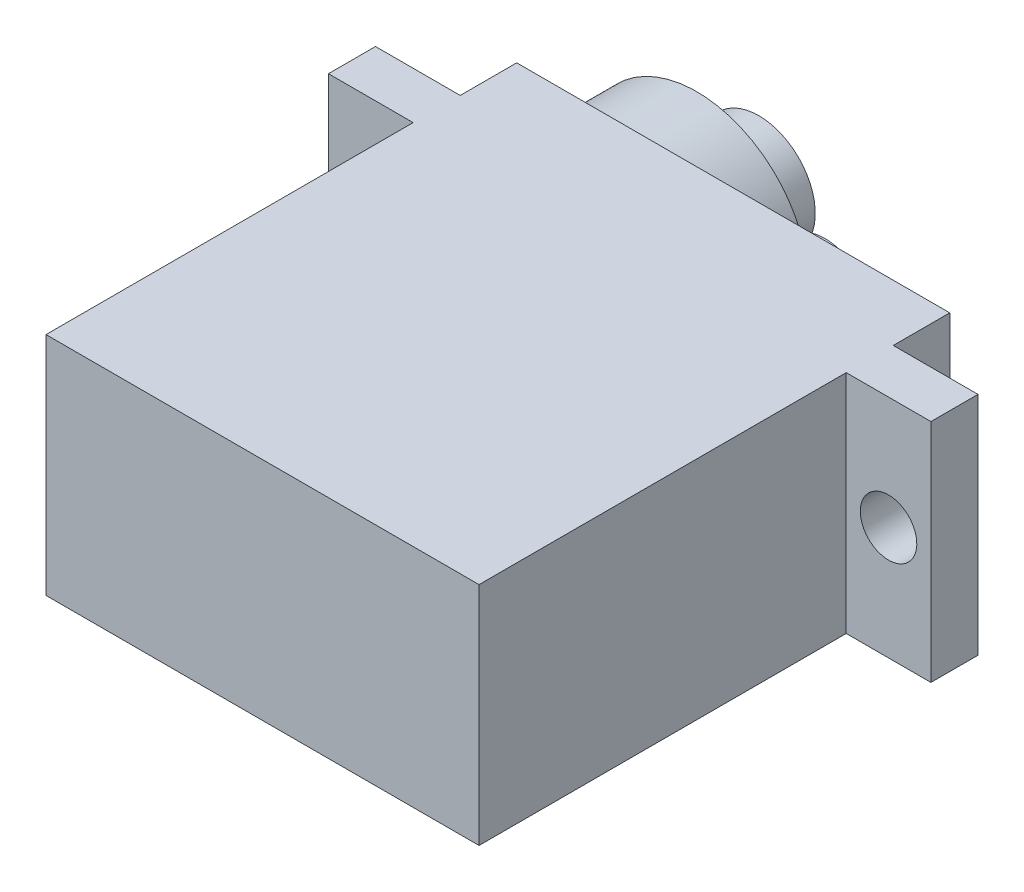
from build123d import *

# Parameters (mm, degrees)
SKETCH1_W            = 23
SKETCH1_H            = 12
BOSS_EXTRUDE1_DEPTH  = 25
SKETCH3_W            = 2.5
SKETCH3_H            = 12
BOSS_EXTRUDE2_DEPTH  = 4.5
SKETCH4_W            = 2.5
SKETCH4_H            = 12
BOSS_EXTRUDE3_DEPTH  = 4.5
BOSS_EXTRUDE13_DEPTH = 3.5
SKETCH7_R            = 3
BOSS_EXTRUDE14_DEPTH = 3.5
SKETCH8_R            = 1.5
CUT_EXTRUDE1_DEPTH   = 3.5
SKETCH9_W            = 0.717948718
SKETCH9_H            = 0.583333333
CUT_EXTRUDE2_DEPTH   = 3.5
CUT_EXTRUDE3_DEPTH   = 3.5


with BuildPart() as part:
    # Sketch1 → Boss-Extrude1 (new body)
    with BuildSketch(Plane.XY):
        Rectangle(SKETCH1_W, SKETCH1_H)
    extrude(amount=BOSS_EXTRUDE1_DEPTH)

    # Sketch3 → Boss-Extrude2 (add)
    with BuildSketch(Plane(origin=(11.5, 0, 0), x_dir=(0, 0, -1), z_dir=(1, 0, 0))):
        with Locations((-4.25, 0)):
            Rectangle(SKETCH3_W, SKETCH3_H)
    extrude(amount=BOSS_EXTRUDE2_DEPTH)

    # Sketch4 → Boss-Extrude3 (add)
    with BuildSketch(Plane.ZY.offset(11.5)):
        with Locations((4.25, 0)):
            Rectangle(SKETCH4_W, SKETCH4_H)
    extrude(amount=BOSS_EXTRUDE3_DEPTH)

    # Sketch5 → Boss-Extrude13 (add)
    with BuildSketch(Plane(origin=(0, 0, 0), x_dir=(-1, 0, 0), z_dir=(0, 0, -1))):
        with BuildLine():
            ThreePointArc((-0.158800231, -2.021525619), (11.397235464, -0.117666755), (-0.074559549, 2.241264938))
            ThreePointArc((-0.074559549, 2.241264938), (-3.841916946, 0.183487283), (-0.158800231, -2.021525619))
        make_face()
    extrude(amount=BOSS_EXTRUDE13_DEPTH)

    # Sketch7 → Boss-Extrude14 (add)
    with BuildSketch(Plane(origin=(0, 0, -3.5), x_dir=(-1, 0, 0), z_dir=(0, 0, -1))):
        with Locations((5.642948454, 0)):
            Circle(SKETCH7_R)
    extrude(amount=BOSS_EXTRUDE14_DEPTH)

    # Sketch8 → Cut-Extrude1 (cut)
    with BuildSketch(Plane(origin=(0, 0, 3), x_dir=(-1, 0, 0), z_dir=(0, 0, -1))):
        with Locations((13.75, 0)):
            Circle(SKETCH8_R)
        with Locations((-13.75, 0)):
            Circle(SKETCH8_R)
    extrude(amount=-CUT_EXTRUDE1_DEPTH, mode=Mode.SUBTRACT)

    # Sketch9 → Cut-Extrude2 (cut)
    # profile 1 of 11: a face of its own
    with BuildSketch(Plane(origin=(0, -6, 0), x_dir=(-1, 0, 0), z_dir=(0, -1, 0))):
        with BuildLine():
            Line((-7.029498247, -7.323823988), (-7.298027894, -7.753611648))
            add(Edge.make_bspline(
                [(-7.298027894, -7.753611648), (-7.309343943, -7.725405147), (-7.330742745, -7.67206627), (-7.366596226, -7.599110292), (-7.402048427, -7.536976801), (-7.437669123, -7.486031044), (-7.473342813, -7.445609931), (-7.510051839, -7.416967875), (-7.547391075, -7.398209945), (-7.57315305, -7.395794026), (-7.58548783, -7.394637289)],
                knots=[0, 0, 0, 0, 1.513815615, 2.862645992, 4.047036384, 5.074482221, 5.956489264, 6.720440714, 7.387349671, 8, 8, 8, 8], degree=3))
            add(Edge.make_bspline(
                [(-7.58548783, -7.394637289), (-7.597078949, -7.395347529), (-7.619923321, -7.396747306), (-7.652145088, -7.411117835), (-7.679882705, -7.434714408), (-7.703986223, -7.465346606), (-7.722832591, -7.501258769), (-7.73746031, -7.540032256), (-7.745812547, -7.581245339), (-7.746899403, -7.609612593), (-7.747446965, -7.623904116)],
                knots=[0, 0, 0, 0, 0.893609532, 1.761171542, 2.674367376, 3.692096672, 4.7611719, 5.803554826, 6.893423158, 8, 8, 8, 8], degree=3))
            add(Edge.make_bspline(
                [(-7.747446965, -7.623904116), (-7.746040801, -7.652926504), (-7.743255996, -7.710403249), (-7.724018118, -7.764627863), (-7.714494241, -7.791472225)],
                knots=[0, 0, 0, 0, 1.009882784, 2, 2, 2, 2], degree=3))
            add(Edge.make_bspline(
                [(-7.714494241, -7.791472225), (-7.70993126, -7.801576539), (-7.699600847, -7.824452317), (-7.679228853, -7.861731129), (-7.65443256, -7.907087444), (-7.623173349, -7.95968464), (-7.586968291, -8.019905491), (-7.544375288, -8.087358866), (-7.497172041, -8.16291293), (-7.463105842, -8.215468417), (-7.445263471, -8.242994661)],
                knots=[0, 0, 0, 0, 0.505642727, 1.144755719, 1.936997808, 2.864123586, 3.935666884, 5.142716957, 6.503481291, 8, 8, 8, 8], degree=3))
            add(Edge.make_bspline(
                [(-7.445263471, -8.242994661), (-7.428433752, -8.268466401), (-7.396524634, -8.316760774), (-7.351220266, -8.385429738), (-7.31258455, -8.447596047), (-7.276744718, -8.500875631), (-7.248657862, -8.548471469), (-7.223632855, -8.587378257), (-7.204722279, -8.619436993), (-7.194447371, -8.638634446), (-7.190055138, -8.646840815)],
                knots=[0, 0, 0, 0, 1.533370667, 2.907268025, 4.131626108, 5.209286774, 6.131298802, 6.906451117, 7.532538771, 8, 8, 8, 8], degree=3))
            add(Edge.make_bspline(
                [(-7.190055138, -8.646840815), (-7.172396418, -8.680546144), (-7.137886386, -8.746415698), (-7.093555709, -8.845726366), (-7.058270283, -8.94329484), (-7.030486093, -9.039544956), (-7.010140983, -9.136863357), (-6.995389221, -9.237289148), (-6.986011594, -9.341940728), (-6.985092666, -9.413380616), (-6.984626452, -9.44962527)],
                knots=[0, 0, 0, 0, 1.089275112, 2.128745462, 3.110876915, 4.057562893, 4.994575095, 5.955064899, 6.96251288, 8, 8, 8, 8], degree=3))
            add(Edge.make_bspline(
                [(-6.984626452, -9.44962527), (-6.985200407, -9.484929111), (-6.986323112, -9.553986437), (-6.994070481, -9.655363931), (-7.007053572, -9.751906874), (-7.026326206, -9.843603726), (-7.049890785, -9.930895441), (-7.079250427, -10.013384977), (-7.113820498, -10.091269489), (-7.153288607, -10.163620799), (-7.197254773, -10.229263325), (-7.244045537, -10.287406565), (-7.294789099, -10.336398045), (-7.349269969, -10.375896445), (-7.406665014, -10.407331907), (-7.467504995, -10.429980486), (-7.531821505, -10.443719884), (-7.575838856, -10.445180426), (-7.598108023, -10.44591934)],
                knots=[0, 0, 0, 0, 1.308901514, 2.560323035, 3.767398777, 4.917911796, 6.032053414, 7.117382618, 8.160844707, 9.188500245, 10.169045156, 11.086613897, 11.950745906, 12.775760447, 13.574509779, 14.369631732, 15.175167501, 16, 16, 16, 16], degree=3))
            add(Edge.make_bspline(
                [(-7.598108023, -10.44591934), (-7.615672816, -10.445404716), (-7.650308144, -10.444389947), (-7.70132971, -10.435565342), (-7.750573765, -10.421722693), (-7.798106651, -10.401495443), (-7.844280041, -10.376687509), (-7.888121693, -10.345117885), (-7.930256479, -10.308423051), (-7.97127568, -10.26630974), (-8.009624417, -10.217128995), (-8.047762594, -10.162752006), (-8.083069282, -10.101044351), (-8.118630879, -10.033881483), (-8.150934908, -9.959491072), (-8.182599858, -9.87900756), (-8.213675398, -9.792456372), (-8.231747156, -9.731804288), (-8.241036709, -9.700626872)],
                knots=[0, 0, 0, 0, 0.796343935, 1.570279377, 2.342178525, 3.112109005, 3.909229001, 4.715324593, 5.557166864, 6.44198091, 7.377558535, 8.383433228, 9.452692693, 10.600350218, 11.829778021, 13.129265353, 14.524336153, 16, 16, 16, 16], degree=3))
            Line((-8.241036709, -9.700626872), (-7.932543119, -9.368996263))
            add(Edge.make_bspline(
                [(-7.932543119, -9.368996263), (-7.920967347, -9.404169009), (-7.899161549, -9.470425484), (-7.863209485, -9.562231234), (-7.824656248, -9.639491931), (-7.785829595, -9.703495837), (-7.745247411, -9.753791903), (-7.702909219, -9.789765423), (-7.658524534, -9.813526945), (-7.627344513, -9.816341078), (-7.612130459, -9.817714212)],
                knots=[0, 0, 0, 0, 1.528548029, 2.879394288, 4.065931244, 5.088610491, 5.965669334, 6.719195773, 7.375041301, 8, 8, 8, 8], degree=3))
            add(Edge.make_bspline(
                [(-7.612130459, -9.817714212), (-7.596711982, -9.816567756), (-7.566047872, -9.814287695), (-7.523157313, -9.793375674), (-7.484154899, -9.761388037), (-7.451208415, -9.717325694), (-7.42351825, -9.665965963), (-7.403045396, -9.609540189), (-7.3909015, -9.548998342), (-7.38929582, -9.507407017), (-7.388472606, -9.486083603)],
                knots=[0, 0, 0, 0, 0.837168625, 1.664952531, 2.553613952, 3.571843386, 4.645016646, 5.730630069, 6.836519038, 8, 8, 8, 8], degree=3))
            add(Edge.make_bspline(
                [(-7.388472606, -9.486083603), (-7.388967485, -9.466184138), (-7.389962443, -9.426176072), (-7.399541042, -9.366265812), (-7.415018915, -9.306399624), (-7.433365102, -9.256392682), (-7.452100276, -9.214447434), (-7.469792333, -9.178751228), (-7.490536749, -9.138705908), (-7.516347866, -9.095577405), (-7.54413424, -9.047470668), (-7.57632928, -8.995751899), (-7.613135655, -8.940656896), (-7.638332314, -8.902300301), (-7.651393279, -8.882417738)],
                knots=[0, 0, 0, 0, 1.070477827, 2.152205962, 3.256735731, 4.394924439, 5.014414402, 5.728928141, 6.539236128, 7.441139399, 8.433599816, 9.529715778, 10.719501013, 12, 12, 12, 12], degree=3))
            add(Edge.make_bspline(
                [(-7.651393279, -8.882417738), (-7.676819062, -8.844678156), (-7.725791945, -8.771987529), (-7.793704535, -8.664800969), (-7.855877844, -8.565077118), (-7.909485343, -8.470828053), (-7.957451469, -8.384147933), (-7.998422152, -8.30407152), (-8.032150964, -8.230632702), (-8.067728126, -8.14223749), (-8.100790695, -8.035415776), (-8.129705466, -7.908163875), (-8.148165008, -7.781028603), (-8.150255293, -7.696179758), (-8.151293119, -7.654052353)],
                knots=[0, 0, 0, 0, 1.215094936, 2.340407834, 3.38829717, 4.352808642, 5.235400207, 6.033645607, 6.754161491, 7.392715116, 8.577000407, 9.735214796, 10.875535395, 12, 12, 12, 12], degree=3))
            add(Edge.make_bspline(
                [(-8.151293119, -7.654052353), (-8.150637107, -7.624128785), (-8.149348939, -7.565369739), (-8.142675372, -7.478642994), (-8.129617343, -7.395419026), (-8.113359544, -7.315083461), (-8.090559094, -7.238345333), (-8.063181821, -7.164892487), (-8.031881703, -7.094198385), (-7.994840244, -7.028300352), (-7.954630779, -6.967760444), (-7.912166987, -6.91376928), (-7.866172711, -6.86899738), (-7.819113161, -6.830839287), (-7.768744329, -6.801693794), (-7.715955418, -6.781376969), (-7.660850155, -6.768897039), (-7.623413368, -6.767261849), (-7.604418119, -6.766432161)],
                knots=[0, 0, 0, 0, 1.254354283, 2.463097322, 3.641944594, 4.783035432, 5.895733406, 6.992845328, 8.066935729, 9.132461787, 10.156622158, 11.111156399, 12.004638905, 12.841397578, 13.64445675, 14.432075676, 15.204442572, 16, 16, 16, 16], degree=3))
            add(Edge.make_bspline(
                [(-7.604418119, -6.766432161), (-7.579701186, -6.767957205), (-7.529956598, -6.771026464), (-7.457024144, -6.79520617), (-7.385927751, -6.832795059), (-7.330125303, -6.877173564), (-7.285117732, -6.919763239), (-7.250970324, -6.959816511), (-7.21527572, -7.004925927), (-7.179413926, -7.056929623), (-7.142445177, -7.114544696), (-7.10547456, -7.179008561), (-7.066580015, -7.248726594), (-7.042133538, -7.298235203), (-7.029498247, -7.323823988)],
                knots=[0, 0, 0, 0, 1.053770877, 2.120788981, 3.250439966, 4.474277998, 5.151977451, 5.894695425, 6.719345712, 7.608185047, 8.591126753, 9.642247106, 10.781383004, 12, 12, 12, 12], degree=3))
        make_face()
    # profile 2 of 11: a face of its own
    with BuildSketch(Plane(origin=(0, -6, 0), x_dir=(-1, 0, 0), z_dir=(0, -1, 0))):
        with BuildLine():
            Line((-5.146285106, -9.234380879), (-6.311549529, -9.234380879))
            add(Edge.make_bspline(
                [(-6.311549529, -9.234380879), (-6.306325159, -9.280079102), (-6.296359408, -9.367250772), (-6.268727943, -9.490307519), (-6.229548505, -9.598535661), (-6.187741691, -9.678199446), (-6.148740521, -9.732350742), (-6.118623352, -9.767579666), (-6.085313316, -9.796155281), (-6.050845986, -9.820248631), (-6.014804807, -9.839678394), (-5.976489363, -9.853067752), (-5.936064353, -9.860866812), (-5.908438342, -9.862006253), (-5.894382061, -9.862586007)],
                knots=[0, 0, 0, 0, 2.00293182, 3.820693659, 5.479502867, 7.005516046, 7.72038845, 8.384130814, 9.019139803, 9.626361114, 10.213887248, 10.796719121, 11.387763407, 12, 12, 12, 12], degree=3))
            add(Edge.make_bspline(
                [(-5.894382061, -9.862586007), (-5.877468488, -9.861809188), (-5.843861484, -9.860265661), (-5.794919901, -9.846819394), (-5.747468972, -9.826147635), (-5.70222997, -9.796524467), (-5.658944615, -9.758482923), (-5.617538862, -9.712633541), (-5.57818911, -9.658118901), (-5.554691698, -9.617878529), (-5.54241892, -9.596860847)],
                knots=[0, 0, 0, 0, 0.874505432, 1.73762853, 2.610205243, 3.546913647, 4.52501498, 5.587546354, 6.739967356, 8, 8, 8, 8], degree=3))
            Line((-5.54241892, -9.596860847), (-5.234626452, -9.847161328))
            add(Edge.make_bspline(
                [(-5.234626452, -9.847161328), (-5.254531798, -9.891544655), (-5.292638075, -9.976510946), (-5.361340284, -10.09123749), (-5.435863388, -10.187879858), (-5.516304942, -10.267017519), (-5.605185723, -10.326970484), (-5.701153325, -10.37072263), (-5.805648333, -10.396409631), (-5.877882453, -10.399481302), (-5.914714593, -10.401047545)],
                knots=[0, 0, 0, 0, 1.245748866, 2.384829348, 3.417529423, 4.366306972, 5.263314617, 6.150552003, 7.056967443, 8, 8, 8, 8], degree=3))
            add(Edge.make_bspline(
                [(-5.914714593, -10.401047545), (-5.943789025, -10.400079317), (-6.00085766, -10.398178834), (-6.084282705, -10.379817486), (-6.16328874, -10.350159208), (-6.238485608, -10.309030801), (-6.309156313, -10.255749198), (-6.374998152, -10.190284993), (-6.437950244, -10.11440961), (-6.494215025, -10.02657624), (-6.547012456, -9.931438062), (-6.591428203, -9.828256281), (-6.630247513, -9.719986705), (-6.660779861, -9.605414281), (-6.685525816, -9.485369208), (-6.702702657, -9.359114038), (-6.713489957, -9.2270912), (-6.714752274, -9.137180149), (-6.715395683, -9.091352033)],
                knots=[0, 0, 0, 0, 0.821815462, 1.613097244, 2.404213167, 3.20336093, 4.030085173, 4.899993948, 5.825570722, 6.814305267, 7.847285877, 8.901600145, 9.989363176, 11.099614129, 12.254019607, 13.455929952, 14.703274657, 16, 16, 16, 16], degree=3))
            add(Edge.make_bspline(
                [(-6.715395683, -9.091352033), (-6.714769522, -9.04435348), (-6.713540495, -8.95210487), (-6.702536354, -8.817110275), (-6.686390583, -8.687948635), (-6.661331541, -8.565185413), (-6.631125171, -8.448064461), (-6.592895396, -8.337295051), (-6.548210201, -8.232619605), (-6.496698359, -8.135148557), (-6.440300083, -8.0464389), (-6.380502959, -7.967795745), (-6.315564782, -7.902248154), (-6.247653554, -7.848177884), (-6.176588259, -7.805112374), (-6.101058136, -7.77585536), (-6.022509258, -7.756335671), (-5.968585177, -7.754525606), (-5.941357221, -7.753611648)],
                knots=[0, 0, 0, 0, 1.327688858, 2.605983448, 3.824748862, 5.003224592, 6.143621814, 7.239960965, 8.310787262, 9.356458241, 10.351137754, 11.278365338, 12.142196764, 12.950725969, 13.72647493, 14.479375456, 15.232189105, 16, 16, 16, 16], degree=3))
            add(Edge.make_bspline(
                [(-5.941357221, -7.753611648), (-5.912517194, -7.754592788), (-5.855683847, -7.756526262), (-5.772498053, -7.77486093), (-5.693647462, -7.804355117), (-5.618628453, -7.845763054), (-5.548862021, -7.899505749), (-5.482620753, -7.96437921), (-5.421343925, -8.041231889), (-5.364068682, -8.128773716), (-5.312644593, -8.225783835), (-5.267853702, -8.330982123), (-5.228897216, -8.443258005), (-5.198852348, -8.563555764), (-5.17370723, -8.690751897), (-5.157747676, -8.825776848), (-5.146685417, -8.968237405), (-5.145493706, -9.065854814), (-5.144882862, -9.115891295)],
                knots=[0, 0, 0, 0, 0.792468507, 1.561671118, 2.330712499, 3.101927644, 3.909457693, 4.746001565, 5.646670277, 6.607816118, 7.620234016, 8.662823515, 9.750583281, 10.885796409, 12.071047244, 13.315069537, 14.623765234, 16, 16, 16, 16], degree=3))
            Line((-5.144882862, -9.115891295), (-5.146285106, -9.234380879))
        make_face()
        with BuildLine():
            add(Edge.make_bspline(
                [(-5.548729016, -8.740791135), (-5.555269335, -8.709063276), (-5.56796213, -8.647489026), (-5.597928429, -8.561060973), (-5.63708051, -8.484067767), (-5.683276893, -8.417037619), (-5.73613521, -8.361806873), (-5.794461369, -8.321156473), (-5.858157507, -8.296426663), (-5.90235469, -8.293527713), (-5.924530298, -8.292073186)],
                knots=[0, 0, 0, 0, 1.225910497, 2.379124237, 3.451785653, 4.487896126, 5.451744876, 6.330575134, 7.162378472, 8, 8, 8, 8], degree=3))
            add(Edge.make_bspline(
                [(-5.924530298, -8.292073186), (-5.948659415, -8.293511394), (-5.99682712, -8.296382412), (-6.065158946, -8.325747693), (-6.129540604, -8.369808124), (-6.164277485, -8.41076255), (-6.182543119, -8.432297545)],
                knots=[0, 0, 0, 0, 0.947074985, 1.890596711, 2.890816105, 4, 4, 4, 4], degree=3))
            add(Edge.make_bspline(
                [(-6.182543119, -8.432297545), (-6.194563645, -8.44926456), (-6.221246631, -8.486927688), (-6.25161414, -8.557557476), (-6.284585999, -8.642719583), (-6.302110697, -8.706460286), (-6.311549529, -8.740791135)],
                knots=[0, 0, 0, 0, 0.740226917, 1.643144803, 2.730593836, 4, 4, 4, 4], degree=3))
            Line((-6.311549529, -8.740791135), (-5.548729016, -8.740791135))
        make_face(mode=Mode.SUBTRACT)
    # profile 3 of 11: a face of its own
    with BuildSketch(Plane(origin=(0, -6, 0), x_dir=(-1, 0, 0), z_dir=(0, -1, 0))):
        with BuildLine():
            Line((-4.875652093, -7.798483443), (-4.516677734, -7.798483443))
            Line((-4.516677734, -7.798483443), (-4.516677734, -8.113287129))
            add(Edge.make_bspline(
                [(-4.516677734, -8.113287129), (-4.509152221, -8.08558455), (-4.494819951, -8.032825245), (-4.468029556, -7.960001417), (-4.436861909, -7.897954746), (-4.402979733, -7.846403038), (-4.365704323, -7.805550557), (-4.326032337, -7.776201501), (-4.284386769, -7.756803574), (-4.255347877, -7.754660448), (-4.241136869, -7.753611648)],
                knots=[0, 0, 0, 0, 1.423334253, 2.710726865, 3.840736876, 4.859788011, 5.761921624, 6.566363284, 7.298409075, 8, 8, 8, 8], degree=3))
            add(Edge.make_bspline(
                [(-4.241136869, -7.753611648), (-4.230784773, -7.754621592), (-4.209079113, -7.756739183), (-4.176137948, -7.768289243), (-4.143971776, -7.789644485), (-4.12360535, -7.80734768), (-4.11283158, -7.81671261)],
                knots=[0, 0, 0, 0, 0.851681845, 1.785755831, 2.828672471, 4, 4, 4, 4], degree=3))
            Line((-4.11283158, -7.81671261), (-4.21028751, -8.348864052))
            add(Edge.make_bspline(
                [(-4.21028751, -8.348864052), (-4.219040043, -8.340528617), (-4.235043981, -8.325287338), (-4.258474749, -8.306750341), (-4.280063556, -8.294687373), (-4.294316354, -8.29288467), (-4.300732221, -8.292073186)],
                knots=[0, 0, 0, 0, 1.329240489, 2.430505927, 3.293495475, 4, 4, 4, 4], degree=3))
            add(Edge.make_bspline(
                [(-4.300732221, -8.292073186), (-4.306652183, -8.292675533), (-4.319056295, -8.29393763), (-4.337127405, -8.302890747), (-4.353021257, -8.318460753), (-4.368799902, -8.338742781), (-4.384066934, -8.364567001), (-4.397749667, -8.396858786), (-4.411789769, -8.434151991), (-4.424465191, -8.478239234), (-4.436868726, -8.530258462), (-4.445989533, -8.592927592), (-4.454372485, -8.666579242), (-4.461167527, -8.751237733), (-4.466665749, -8.846847454), (-4.470976672, -8.953429094), (-4.472786842, -9.071013014), (-4.473063797, -9.153050472), (-4.473208183, -9.19581918)],
                knots=[0, 0, 0, 0, 0.296809874, 0.621906527, 0.987026169, 1.404480485, 1.909126721, 2.486431564, 3.16151366, 3.907118283, 4.785817413, 5.842019697, 7.080977384, 8.504330977, 10.101453798, 11.884780886, 13.854606785, 16, 16, 16, 16], degree=3))
            Line((-4.473208183, -9.19581918), (-4.471805939, -9.32061886))
            Line((-4.471805939, -9.32061886), (-4.471805939, -10.356175751))
            Line((-4.471805939, -10.356175751), (-4.875652093, -10.356175751))
            Line((-4.875652093, -10.356175751), (-4.875652093, -7.798483443))
        make_face()
    # profile 4 of 11: a face of its own
    with BuildSketch(Plane(origin=(0, -6, 0), x_dir=(-1, 0, 0), z_dir=(0, -1, 0))):
        Polygon((-4.135267478, -7.798483443), (-3.720904497, -7.798483443), (-3.372446965, -9.307998667), (-3.025391677, -7.798483443), (-2.609626452, -7.798483443), (-3.197166516, -10.356175751), (-3.547026292, -10.356175751), align=None)
    # profile 5 of 11: a face of its own
    with BuildSketch(Plane(origin=(0, -6, 0), x_dir=(-1, 0, 0), z_dir=(0, -1, 0))):
        with BuildLine():
            add(Edge.make_bspline(
                [(-1.586689753, -7.753611648), (-1.56913012, -7.754153523), (-1.534043569, -7.755236265), (-1.481830128, -7.763945582), (-1.430576268, -7.778286737), (-1.379666167, -7.796814775), (-1.330312244, -7.822883806), (-1.281512542, -7.853515202), (-1.23321266, -7.889619504), (-1.170529875, -7.946474736), (-1.095620789, -8.028035742), (-1.017644612, -8.142278298), (-0.950486971, -8.27251217), (-0.893821535, -8.41660787), (-0.848773065, -8.57159092), (-0.81579486, -8.734057126), (-0.795688692, -8.902709892), (-0.793452019, -9.017211508), (-0.79231876, -9.075226231)],
                knots=[0, 0, 0, 0, 0.498953948, 0.996978292, 1.499809037, 2.010650751, 2.533574202, 3.082841117, 3.647519731, 4.245008617, 5.486430885, 6.785561185, 8.164293431, 9.643418898, 11.180142746, 12.746181886, 14.351382572, 16, 16, 16, 16], degree=3))
            add(Edge.make_bspline(
                [(-0.79231876, -9.075226231), (-0.793450515, -9.133708309), (-0.795684403, -9.24914181), (-0.815816407, -9.419185645), (-0.848801485, -9.583574845), (-0.894390361, -9.740357172), (-0.951240496, -9.885912806), (-1.017106852, -10.017147004), (-1.095232524, -10.130097055), (-1.167348242, -10.212334939), (-1.230190889, -10.267035559), (-1.277062999, -10.303323175), (-1.325553952, -10.333410002), (-1.374960304, -10.358334404), (-1.425725807, -10.377460354), (-1.477982676, -10.390549883), (-1.53123144, -10.39947694), (-1.567256169, -10.400523643), (-1.58528751, -10.401047545)],
                knots=[0, 0, 0, 0, 1.656264952, 3.269180419, 4.842891851, 6.401686251, 7.888119366, 9.265016889, 10.550538073, 11.769515322, 12.351239632, 12.908722698, 13.447003998, 13.965161284, 14.474272309, 14.980100942, 15.489513229, 16, 16, 16, 16], degree=3))
            add(Edge.make_bspline(
                [(-1.58528751, -10.401047545), (-1.611788625, -10.399747841), (-1.664205912, -10.397177119), (-1.741307704, -10.379149547), (-1.814910405, -10.348398616), (-1.885579108, -10.305668126), (-1.953505769, -10.251001222), (-2.01759198, -10.183666702), (-2.079893203, -10.105425058), (-2.136848867, -10.015380911), (-2.189909642, -9.917368345), (-2.236050108, -9.812704111), (-2.275283117, -9.703029219), (-2.307912784, -9.588348928), (-2.33177345, -9.468189943), (-2.350405044, -9.343305763), (-2.360852019, -9.21305946), (-2.36216312, -9.124556129), (-2.36283158, -9.079432962)],
                knots=[0, 0, 0, 0, 0.757268579, 1.497822431, 2.249620092, 3.028674568, 3.8507904, 4.734238136, 5.680514419, 6.70524415, 7.775287347, 8.863936352, 9.971180801, 11.102605878, 12.268626126, 13.470344302, 14.710262363, 16, 16, 16, 16], degree=3))
            add(Edge.make_bspline(
                [(-2.36283158, -9.079432962), (-2.36198828, -9.031266286), (-2.360335868, -8.936885713), (-2.348434169, -8.798435518), (-2.328005652, -8.666151393), (-2.300110978, -8.539852281), (-2.264552822, -8.41944134), (-2.220235742, -8.305481146), (-2.167729334, -8.197527373), (-2.126182485, -8.130029233), (-2.105519882, -8.096460206)],
                knots=[0, 0, 0, 0, 1.121811857, 2.198143086, 3.233602208, 4.237311924, 5.208646479, 6.154808683, 7.082326169, 8, 8, 8, 8], degree=3))
            add(Edge.make_bspline(
                [(-2.105519882, -8.096460206), (-2.086863778, -8.069203662), (-2.050972459, -8.016766493), (-1.990847872, -7.946964112), (-1.929072907, -7.887507303), (-1.865175479, -7.838443165), (-1.798554743, -7.800781375), (-1.729910087, -7.77384984), (-1.659014543, -7.756946921), (-1.610852535, -7.75472592), (-1.586689753, -7.753611648)],
                knots=[0, 0, 0, 0, 1.220761442, 2.348547062, 3.400027255, 4.38708449, 5.319780212, 6.220200227, 7.107078062, 8, 8, 8, 8], degree=3))
        make_face()
        with BuildLine():
            add(Edge.make_bspline(
                [(-1.578276292, -8.336944981), (-1.591631348, -8.337754655), (-1.618177287, -8.339364048), (-1.657489175, -8.348179342), (-1.693948855, -8.365808097), (-1.729260203, -8.38869467), (-1.762399985, -8.418293711), (-1.794811462, -8.453793459), (-1.823404799, -8.496984174), (-1.861875626, -8.56272102), (-1.901780468, -8.657078443), (-1.934908246, -8.783377264), (-1.955297424, -8.923828567), (-1.957719445, -9.022335029), (-1.958985427, -9.073823988)],
                knots=[0, 0, 0, 0, 0.531406066, 1.056279542, 1.588172318, 2.131694732, 2.724043708, 3.348779607, 4.036600694, 4.777313526, 6.374828638, 8.087010827, 9.95469519, 12, 12, 12, 12], degree=3))
            add(Edge.make_bspline(
                [(-1.958985427, -9.073823988), (-1.957643168, -9.126702501), (-1.955085026, -9.227480905), (-1.935867363, -9.37108169), (-1.902678958, -9.498956488), (-1.86307906, -9.59397562), (-1.825357358, -9.659724534), (-1.795401148, -9.70141012), (-1.765074113, -9.738084643), (-1.731011455, -9.766468995), (-1.696138263, -9.789974694), (-1.658857655, -9.806133124), (-1.61961714, -9.815375748), (-1.59304618, -9.816931517), (-1.579678535, -9.817714212)],
                knots=[0, 0, 0, 0, 2.083844641, 3.971490933, 5.696411459, 7.277284296, 8.011958627, 8.679080092, 9.299544049, 9.881039513, 10.420130978, 10.952331548, 11.472926106, 12, 12, 12, 12], degree=3))
            add(Edge.make_bspline(
                [(-1.579678535, -9.817714212), (-1.566062983, -9.817011198), (-1.539173644, -9.815622815), (-1.500044343, -9.805407021), (-1.462992695, -9.788897133), (-1.42744113, -9.766093212), (-1.393852803, -9.736387453), (-1.362299726, -9.700030335), (-1.331864478, -9.65776583), (-1.294398195, -9.59093628), (-1.253854339, -9.495751283), (-1.220179805, -9.368052738), (-1.199855651, -9.22568146), (-1.197433311, -9.126012918), (-1.196164914, -9.073823988)],
                knots=[0, 0, 0, 0, 0.535648601, 1.05785183, 1.581026902, 2.127240038, 2.714100245, 3.339916738, 4.019124428, 4.76094841, 6.352116621, 8.077481587, 9.946071712, 12, 12, 12, 12], degree=3))
            add(Edge.make_bspline(
                [(-1.196164914, -9.073823988), (-1.197505926, -9.02164797), (-1.200060151, -8.922268393), (-1.219293688, -8.780498167), (-1.252714787, -8.654169642), (-1.291706605, -8.559716129), (-1.330325832, -8.49484403), (-1.359142535, -8.452301573), (-1.391112544, -8.417135783), (-1.424262979, -8.387416684), (-1.460252628, -8.365143015), (-1.497843512, -8.348317324), (-1.537664604, -8.339322334), (-1.564682554, -8.33774074), (-1.578276292, -8.336944981)],
                knots=[0, 0, 0, 0, 2.065846563, 3.934814648, 5.649911842, 7.229656319, 7.959772155, 8.637571837, 9.260110413, 9.837317662, 10.3945175, 10.929205137, 11.461243205, 12, 12, 12, 12], degree=3))
        make_face(mode=Mode.SUBTRACT)
    # profile 6 of 11: a face of its own
    with BuildSketch(Plane(origin=(0, -6, 0), x_dir=(-1, 0, 0), z_dir=(0, -1, 0))):
        with Locations((-0.029498247, -9.077329597)):
            Rectangle(SKETCH9_W, SKETCH9_H)
    # profile 7 of 11: a face of its own
    with BuildSketch(Plane(origin=(0, -6, 0), x_dir=(-1, 0, 0), z_dir=(0, -1, 0))):
        Polygon((0.909303836, -6.856175751), (1.390974509, -6.856175751), (1.787809445, -9.29748184), (2.186046625, -6.856175751), (2.664211689, -6.856175751), (2.976912009, -10.356175751), (2.568158003, -10.356175751), (2.371142779, -8.145538731), (2.010766176, -10.356175751), (1.563450471, -10.356175751), (1.204476112, -8.145538731), (1.008162009, -10.356175751), (0.598706881, -10.356175751), align=None)
    # profile 8 of 11: a face of its own
    with BuildSketch(Plane(origin=(0, -6, 0), x_dir=(-1, 0, 0), z_dir=(0, -1, 0))):
        with BuildLine():
            add(Edge.make_bspline(
                [(4.022284606, -7.753611648), (4.039844239, -7.754153523), (4.07493079, -7.755236265), (4.127144231, -7.763945582), (4.178398091, -7.778286737), (4.229308192, -7.796814775), (4.278662115, -7.822883806), (4.327461817, -7.853515202), (4.375761699, -7.889619504), (4.438444484, -7.946474736), (4.51335357, -8.028035742), (4.591329747, -8.142278298), (4.658487388, -8.27251217), (4.715152824, -8.41660787), (4.760201294, -8.57159092), (4.793179499, -8.734057126), (4.813285667, -8.902709892), (4.81552234, -9.017211508), (4.816655599, -9.075226231)],
                knots=[0, 0, 0, 0, 0.498953948, 0.996978292, 1.499809037, 2.010650751, 2.533574202, 3.082841117, 3.647519731, 4.245008617, 5.486430885, 6.785561185, 8.164293431, 9.643418898, 11.180142746, 12.746181886, 14.351382572, 16, 16, 16, 16], degree=3))
            add(Edge.make_bspline(
                [(4.816655599, -9.075226231), (4.815523844, -9.133708309), (4.813289956, -9.24914181), (4.793157952, -9.419185645), (4.760172874, -9.583574845), (4.714583998, -9.740357172), (4.657733863, -9.885912806), (4.591867507, -10.017147004), (4.513741835, -10.130097055), (4.441626117, -10.212334939), (4.37878347, -10.267035559), (4.33191136, -10.303323175), (4.283420407, -10.333410002), (4.234014055, -10.358334404), (4.183248552, -10.377460354), (4.130991683, -10.390549883), (4.077742919, -10.39947694), (4.04171819, -10.400523643), (4.023686849, -10.401047545)],
                knots=[0, 0, 0, 0, 1.656264952, 3.269180419, 4.842891851, 6.401686251, 7.888119366, 9.265016889, 10.550538073, 11.769515322, 12.351239632, 12.908722698, 13.447003998, 13.965161284, 14.474272309, 14.980100942, 15.489513229, 16, 16, 16, 16], degree=3))
            add(Edge.make_bspline(
                [(4.023686849, -10.401047545), (3.997185734, -10.399747841), (3.944768447, -10.397177119), (3.867666655, -10.379149547), (3.794063954, -10.348398616), (3.723395251, -10.305668126), (3.65546859, -10.251001222), (3.591382379, -10.183666702), (3.529081156, -10.105425058), (3.472125492, -10.015380911), (3.419064717, -9.917368345), (3.372924251, -9.812704111), (3.333691242, -9.703029219), (3.301061575, -9.588348928), (3.277200909, -9.468189943), (3.258569315, -9.343305763), (3.24812234, -9.21305946), (3.246811239, -9.124556129), (3.246142779, -9.079432962)],
                knots=[0, 0, 0, 0, 0.757268579, 1.497822431, 2.249620092, 3.028674568, 3.8507904, 4.734238136, 5.680514419, 6.70524415, 7.775287347, 8.863936352, 9.971180801, 11.102605878, 12.268626126, 13.470344302, 14.710262363, 16, 16, 16, 16], degree=3))
            add(Edge.make_bspline(
                [(3.246142779, -9.079432962), (3.246986079, -9.031266286), (3.248638491, -8.936885713), (3.26054019, -8.798435518), (3.280968707, -8.666151393), (3.308863381, -8.539852281), (3.344421537, -8.41944134), (3.388738617, -8.305481146), (3.441245025, -8.197527373), (3.482791874, -8.130029233), (3.503454477, -8.096460206)],
                knots=[0, 0, 0, 0, 1.121811857, 2.198143086, 3.233602208, 4.237311924, 5.208646479, 6.154808683, 7.082326169, 8, 8, 8, 8], degree=3))
            add(Edge.make_bspline(
                [(3.503454477, -8.096460206), (3.522110581, -8.069203662), (3.5580019, -8.016766493), (3.618126487, -7.946964112), (3.679901452, -7.887507303), (3.74379888, -7.838443165), (3.810419616, -7.800781375), (3.879064272, -7.77384984), (3.949959816, -7.756946921), (3.998121824, -7.75472592), (4.022284606, -7.753611648)],
                knots=[0, 0, 0, 0, 1.220761442, 2.348547062, 3.400027255, 4.38708449, 5.319780212, 6.220200227, 7.107078062, 8, 8, 8, 8], degree=3))
        make_face()
        with BuildLine():
            add(Edge.make_bspline(
                [(4.030698067, -8.336944981), (4.017343011, -8.337754655), (3.990797072, -8.339364048), (3.951485184, -8.348179342), (3.915025504, -8.365808097), (3.879714156, -8.38869467), (3.846574373, -8.418293711), (3.814162897, -8.453793459), (3.78556956, -8.496984174), (3.747098733, -8.56272102), (3.707193891, -8.657078443), (3.674066113, -8.783377264), (3.653676935, -8.923828567), (3.651254914, -9.022335029), (3.649988932, -9.073823988)],
                knots=[0, 0, 0, 0, 0.531406066, 1.056279542, 1.588172318, 2.131694732, 2.724043708, 3.348779607, 4.036600694, 4.777313526, 6.374828638, 8.087010827, 9.95469519, 12, 12, 12, 12], degree=3))
            add(Edge.make_bspline(
                [(3.649988932, -9.073823988), (3.651331191, -9.126702501), (3.653889333, -9.227480905), (3.673106996, -9.37108169), (3.706295401, -9.498956488), (3.745895299, -9.59397562), (3.783617, -9.659724534), (3.813573211, -9.70141012), (3.843900246, -9.738084643), (3.877962904, -9.766468995), (3.912836095, -9.789974694), (3.950116704, -9.806133124), (3.989357219, -9.815375748), (4.015928179, -9.816931517), (4.029295823, -9.817714212)],
                knots=[0, 0, 0, 0, 2.083844641, 3.971490933, 5.696411459, 7.277284296, 8.011958627, 8.679080092, 9.299544049, 9.881039513, 10.420130978, 10.952331548, 11.472926106, 12, 12, 12, 12], degree=3))
            add(Edge.make_bspline(
                [(4.029295823, -9.817714212), (4.042911376, -9.817011198), (4.069800715, -9.815622815), (4.108930016, -9.805407021), (4.145981664, -9.788897133), (4.181533229, -9.766093212), (4.215121556, -9.736387453), (4.246674633, -9.700030335), (4.277109881, -9.65776583), (4.314576164, -9.59093628), (4.35512002, -9.495751283), (4.388794554, -9.368052738), (4.409118708, -9.22568146), (4.411541048, -9.126012918), (4.412809445, -9.073823988)],
                knots=[0, 0, 0, 0, 0.535648601, 1.05785183, 1.581026902, 2.127240038, 2.714100245, 3.339916738, 4.019124428, 4.76094841, 6.352116621, 8.077481587, 9.946071712, 12, 12, 12, 12], degree=3))
            add(Edge.make_bspline(
                [(4.412809445, -9.073823988), (4.411468433, -9.02164797), (4.408914208, -8.922268393), (4.389680671, -8.780498167), (4.356259572, -8.654169642), (4.317267754, -8.559716129), (4.278648527, -8.49484403), (4.249831824, -8.452301573), (4.217861815, -8.417135783), (4.18471138, -8.387416684), (4.148721731, -8.365143015), (4.111130847, -8.348317324), (4.071309755, -8.339322334), (4.044291805, -8.33774074), (4.030698067, -8.336944981)],
                knots=[0, 0, 0, 0, 2.065846563, 3.934814648, 5.649911842, 7.229656319, 7.959772155, 8.637571837, 9.260110413, 9.837317662, 10.3945175, 10.929205137, 11.461243205, 12, 12, 12, 12], degree=3))
        make_face(mode=Mode.SUBTRACT)
    # profile 9 of 11: a face of its own
    with BuildSketch(Plane(origin=(0, -6, 0), x_dir=(-1, 0, 0), z_dir=(0, -1, 0))):
        Polygon((5.130758163, -6.766432161), (5.534604317, -6.766432161), (5.534604317, -7.798483443), (5.758963291, -7.798483443), (5.758963291, -8.336944981), (5.534604317, -8.336944981), (5.534604317, -10.356175751), (5.130758163, -10.356175751), (5.130758163, -8.336944981), (4.951270984, -8.336944981), (4.951270984, -7.798483443), (5.130758163, -7.798483443), align=None)
    # profile 10 of 11: a face of its own
    with BuildSketch(Plane(origin=(0, -6, 0), x_dir=(-1, 0, 0), z_dir=(0, -1, 0))):
        with BuildLine():
            add(Edge.make_bspline(
                [(6.714592298, -7.753611648), (6.732151931, -7.754153523), (6.767238482, -7.755236265), (6.819451923, -7.763945582), (6.870705783, -7.778286737), (6.921615884, -7.796814775), (6.970969808, -7.822883806), (7.019769509, -7.853515202), (7.068069392, -7.889619504), (7.130752177, -7.946474736), (7.205661262, -8.028035742), (7.283637439, -8.142278298), (7.350795081, -8.27251217), (7.407460516, -8.41660787), (7.452508986, -8.57159092), (7.485487191, -8.734057126), (7.505593359, -8.902709892), (7.507830032, -9.017211508), (7.508963291, -9.075226231)],
                knots=[0, 0, 0, 0, 0.498953948, 0.996978292, 1.499809037, 2.010650751, 2.533574202, 3.082841117, 3.647519731, 4.245008617, 5.486430885, 6.785561185, 8.164293431, 9.643418898, 11.180142746, 12.746181886, 14.351382572, 16, 16, 16, 16], degree=3))
            add(Edge.make_bspline(
                [(7.508963291, -9.075226231), (7.507831537, -9.133708309), (7.505597649, -9.24914181), (7.485465644, -9.419185645), (7.452480566, -9.583574845), (7.40689169, -9.740357172), (7.350041555, -9.885912806), (7.2841752, -10.017147004), (7.206049527, -10.130097055), (7.133933809, -10.212334939), (7.071091162, -10.267035559), (7.024219052, -10.303323175), (6.975728099, -10.333410002), (6.926321747, -10.358334404), (6.875556245, -10.377460354), (6.823299376, -10.390549883), (6.770050611, -10.39947694), (6.734025882, -10.400523643), (6.715994541, -10.401047545)],
                knots=[0, 0, 0, 0, 1.656264952, 3.269180419, 4.842891851, 6.401686251, 7.888119366, 9.265016889, 10.550538073, 11.769515322, 12.351239632, 12.908722698, 13.447003998, 13.965161284, 14.474272309, 14.980100942, 15.489513229, 16, 16, 16, 16], degree=3))
            add(Edge.make_bspline(
                [(6.715994541, -10.401047545), (6.689493426, -10.399747841), (6.637076139, -10.397177119), (6.559974347, -10.379149547), (6.486371647, -10.348398616), (6.415702943, -10.305668126), (6.347776283, -10.251001222), (6.283690072, -10.183666702), (6.221388848, -10.105425058), (6.164433185, -10.015380911), (6.111372409, -9.917368345), (6.065231943, -9.812704111), (6.025998935, -9.703029219), (5.993369267, -9.588348928), (5.969508601, -9.468189943), (5.950877008, -9.343305763), (5.940430032, -9.21305946), (5.939118932, -9.124556129), (5.938450471, -9.079432962)],
                knots=[0, 0, 0, 0, 0.757268579, 1.497822431, 2.249620092, 3.028674568, 3.8507904, 4.734238136, 5.680514419, 6.70524415, 7.775287347, 8.863936352, 9.971180801, 11.102605878, 12.268626126, 13.470344302, 14.710262363, 16, 16, 16, 16], degree=3))
            add(Edge.make_bspline(
                [(5.938450471, -9.079432962), (5.939293772, -9.031266286), (5.940946183, -8.936885713), (5.952847883, -8.798435518), (5.9732764, -8.666151393), (6.001171073, -8.539852281), (6.03672923, -8.41944134), (6.081046309, -8.305481146), (6.133552717, -8.197527373), (6.175099566, -8.130029233), (6.19576217, -8.096460206)],
                knots=[0, 0, 0, 0, 1.121811857, 2.198143086, 3.233602208, 4.237311924, 5.208646479, 6.154808683, 7.082326169, 8, 8, 8, 8], degree=3))
            add(Edge.make_bspline(
                [(6.19576217, -8.096460206), (6.214418274, -8.069203662), (6.250309592, -8.016766493), (6.310434179, -7.946964112), (6.372209145, -7.887507303), (6.436106573, -7.838443165), (6.502727308, -7.800781375), (6.571371964, -7.77384984), (6.642267508, -7.756946921), (6.690429516, -7.75472592), (6.714592298, -7.753611648)],
                knots=[0, 0, 0, 0, 1.220761442, 2.348547062, 3.400027255, 4.38708449, 5.319780212, 6.220200227, 7.107078062, 8, 8, 8, 8], degree=3))
        make_face()
        with BuildLine():
            add(Edge.make_bspline(
                [(6.723005759, -8.336944981), (6.709650703, -8.337754655), (6.683104764, -8.339364048), (6.643792877, -8.348179342), (6.607333196, -8.365808097), (6.572021848, -8.38869467), (6.538882066, -8.418293711), (6.506470589, -8.453793459), (6.477877253, -8.496984174), (6.439406425, -8.56272102), (6.399501583, -8.657078443), (6.366373805, -8.783377264), (6.345984628, -8.923828567), (6.343562606, -9.022335029), (6.342296625, -9.073823988)],
                knots=[0, 0, 0, 0, 0.531406066, 1.056279542, 1.588172318, 2.131694732, 2.724043708, 3.348779607, 4.036600694, 4.777313526, 6.374828638, 8.087010827, 9.95469519, 12, 12, 12, 12], degree=3))
            add(Edge.make_bspline(
                [(6.342296625, -9.073823988), (6.343638884, -9.126702501), (6.346197025, -9.227480905), (6.365414689, -9.37108169), (6.398603094, -9.498956488), (6.438202991, -9.59397562), (6.475924693, -9.659724534), (6.505880903, -9.70141012), (6.536207938, -9.738084643), (6.570270596, -9.766468995), (6.605143788, -9.789974694), (6.642424396, -9.806133124), (6.681664911, -9.815375748), (6.708235871, -9.816931517), (6.721603516, -9.817714212)],
                knots=[0, 0, 0, 0, 2.083844641, 3.971490933, 5.696411459, 7.277284296, 8.011958627, 8.679080092, 9.299544049, 9.881039513, 10.420130978, 10.952331548, 11.472926106, 12, 12, 12, 12], degree=3))
            add(Edge.make_bspline(
                [(6.721603516, -9.817714212), (6.735219068, -9.817011198), (6.762108407, -9.815622815), (6.801237708, -9.805407021), (6.838289356, -9.788897133), (6.873840922, -9.766093212), (6.907429248, -9.736387453), (6.938982326, -9.700030335), (6.969417573, -9.65776583), (7.006883856, -9.59093628), (7.047427712, -9.495751283), (7.081102247, -9.368052738), (7.1014264, -9.22568146), (7.10384874, -9.126012918), (7.105117138, -9.073823988)],
                knots=[0, 0, 0, 0, 0.535648601, 1.05785183, 1.581026902, 2.127240038, 2.714100245, 3.339916738, 4.019124428, 4.76094841, 6.352116621, 8.077481587, 9.946071712, 12, 12, 12, 12], degree=3))
            add(Edge.make_bspline(
                [(7.105117138, -9.073823988), (7.103776125, -9.02164797), (7.1012219, -8.922268393), (7.081988363, -8.780498167), (7.048567264, -8.654169642), (7.009575446, -8.559716129), (6.970956219, -8.49484403), (6.942139516, -8.452301573), (6.910169507, -8.417135783), (6.877019072, -8.387416684), (6.841029423, -8.365143015), (6.803438539, -8.348317324), (6.763617448, -8.339322334), (6.736599497, -8.33774074), (6.723005759, -8.336944981)],
                knots=[0, 0, 0, 0, 2.065846563, 3.934814648, 5.649911842, 7.229656319, 7.959772155, 8.637571837, 9.260110413, 9.837317662, 10.3945175, 10.929205137, 11.461243205, 12, 12, 12, 12], degree=3))
        make_face(mode=Mode.SUBTRACT)
    # profile 11 of 11: a face of its own
    with BuildSketch(Plane(origin=(0, -6, 0), x_dir=(-1, 0, 0), z_dir=(0, -1, 0))):
        with BuildLine():
            Line((7.778194061, -7.798483443), (8.13716842, -7.798483443))
            Line((8.13716842, -7.798483443), (8.13716842, -8.113287129))
            add(Edge.make_bspline(
                [(8.13716842, -8.113287129), (8.144693933, -8.08558455), (8.159026203, -8.032825245), (8.185816597, -7.960001417), (8.216984245, -7.897954746), (8.250866421, -7.846403038), (8.288141831, -7.805550557), (8.327813816, -7.776201501), (8.369459385, -7.756803574), (8.398498277, -7.754660448), (8.412709285, -7.753611648)],
                knots=[0, 0, 0, 0, 1.423334253, 2.710726865, 3.840736876, 4.859788011, 5.761921624, 6.566363284, 7.298409075, 8, 8, 8, 8], degree=3))
            add(Edge.make_bspline(
                [(8.412709285, -7.753611648), (8.423061381, -7.754621592), (8.444767041, -7.756739183), (8.477708206, -7.768289243), (8.509874378, -7.789644485), (8.530240804, -7.80734768), (8.541014573, -7.81671261)],
                knots=[0, 0, 0, 0, 0.851681845, 1.785755831, 2.828672471, 4, 4, 4, 4], degree=3))
            Line((8.541014573, -7.81671261), (8.443558644, -8.348864052))
            add(Edge.make_bspline(
                [(8.443558644, -8.348864052), (8.434806111, -8.340528617), (8.418802173, -8.325287338), (8.395371404, -8.306750341), (8.373782598, -8.294687373), (8.3595298, -8.29288467), (8.353113932, -8.292073186)],
                knots=[0, 0, 0, 0, 1.329240489, 2.430505927, 3.293495475, 4, 4, 4, 4], degree=3))
            add(Edge.make_bspline(
                [(8.353113932, -8.292073186), (8.347193971, -8.292675533), (8.334789859, -8.29393763), (8.316718749, -8.302890747), (8.300824896, -8.318460753), (8.285046252, -8.338742781), (8.269779219, -8.364567001), (8.256096487, -8.396858786), (8.242056385, -8.434151991), (8.229380962, -8.478239234), (8.216977428, -8.530258462), (8.20785662, -8.592927592), (8.199473669, -8.666579242), (8.192678626, -8.751237733), (8.187180405, -8.846847454), (8.182869482, -8.953429094), (8.181059312, -9.071013014), (8.180782356, -9.153050472), (8.180637971, -9.19581918)],
                knots=[0, 0, 0, 0, 0.296809874, 0.621906527, 0.987026169, 1.404480485, 1.909126721, 2.486431564, 3.16151366, 3.907118283, 4.785817413, 5.842019697, 7.080977384, 8.504330977, 10.101453798, 11.884780886, 13.854606785, 16, 16, 16, 16], degree=3))
            Line((8.180637971, -9.19581918), (8.182040215, -9.32061886))
            Line((8.182040215, -9.32061886), (8.182040215, -10.356175751))
            Line((8.182040215, -10.356175751), (7.778194061, -10.356175751))
            Line((7.778194061, -10.356175751), (7.778194061, -7.798483443))
        make_face()
    extrude(amount=-CUT_EXTRUDE2_DEPTH, mode=Mode.SUBTRACT)

    # Sketch10 → Cut-Extrude3 (cut)
    # profile 1 of 8: a face of its own
    with BuildSketch(Plane(origin=(0, -6, 0), x_dir=(-1, 0, 0), z_dir=(0, -1, 0))):
        Polygon((-7.642122625, -15.872804844), (-7.642122625, -15.513830485), (-6.340840574, -15.513830485), (-6.340840574, -15.872804844), (-6.879302112, -15.872804844), (-6.879302112, -19.013830485), (-7.103661087, -19.013830485), (-7.103661087, -15.872804844), align=None)
    # profile 2 of 8: a face of its own
    with BuildSketch(Plane(origin=(0, -6, 0), x_dir=(-1, 0, 0), z_dir=(0, -1, 0))):
        with BuildLine():
            Line((-4.557887849, -18.206138177), (-4.366481599, -18.352672632))
            add(Edge.make_bspline(
                [(-4.366481599, -18.352672632), (-4.381513376, -18.391972868), (-4.410481023, -18.467708118), (-4.462451851, -18.572831104), (-4.515455601, -18.667579112), (-4.574408271, -18.749539607), (-4.636465777, -18.821066766), (-4.702106679, -18.883148674), (-4.770993848, -18.937069774), (-4.844267623, -18.981630167), (-4.9222005, -19.0164448), (-5.004717335, -19.04080997), (-5.092043656, -19.056106883), (-5.151906656, -19.05782283), (-5.182587369, -19.05870228)],
                knots=[0, 0, 0, 0, 1.308601766, 2.521798669, 3.645743814, 4.683060443, 5.657274123, 6.58840711, 7.490311831, 8.374598661, 9.250351329, 10.138487509, 11.045946063, 12, 12, 12, 12], degree=3))
            add(Edge.make_bspline(
                [(-5.182587369, -19.05870228), (-5.216564336, -19.057538474), (-5.283198334, -19.055256074), (-5.38004128, -19.035883191), (-5.471074872, -19.003900853), (-5.556554283, -18.959614812), (-5.63582067, -18.901607477), (-5.7098296, -18.83190265), (-5.777349669, -18.74882867), (-5.837851297, -18.654601474), (-5.892677944, -18.553213041), (-5.940297003, -18.446908941), (-5.981303334, -18.337438326), (-6.013885185, -18.224335687), (-6.040192693, -18.108519294), (-6.058095227, -17.989230303), (-6.069831686, -17.866798374), (-6.07101339, -17.783856748), (-6.071609804, -17.741995549)],
                knots=[0, 0, 0, 0, 0.92509185, 1.814245716, 2.678212382, 3.546882885, 4.427030283, 5.34596534, 6.309676828, 7.335823642, 8.392879302, 9.447400238, 10.507195009, 11.575183946, 12.651945014, 13.740745465, 14.85973897, 16, 16, 16, 16], degree=3))
            add(Edge.make_bspline(
                [(-6.071609804, -17.741995549), (-6.070817949, -17.702718615), (-6.06925101, -17.624996665), (-6.0603648, -17.509977499), (-6.044071724, -17.398090663), (-6.021485095, -17.289558829), (-5.993909972, -17.183889772), (-5.958282042, -17.08201563), (-5.917447991, -16.982884613), (-5.884643855, -16.919592753), (-5.868284484, -16.888029203)],
                knots=[0, 0, 0, 0, 1.062894307, 2.103275654, 3.119249537, 4.120133516, 5.10187482, 6.071833776, 7.038426566, 8, 8, 8, 8], degree=3))
            add(Edge.make_bspline(
                [(-5.868284484, -16.888029203), (-5.846534795, -16.850444507), (-5.804526211, -16.777851291), (-5.732599911, -16.679658116), (-5.65376082, -16.597384491), (-5.570274348, -16.528890741), (-5.479826603, -16.476619254), (-5.38473111, -16.437917933), (-5.283373547, -16.415904533), (-5.214239836, -16.412829961), (-5.17908176, -16.411266382)],
                knots=[0, 0, 0, 0, 1.178964675, 2.277119279, 3.296241601, 4.266761662, 5.199773736, 6.122712509, 7.045301966, 8, 8, 8, 8], degree=3))
            add(Edge.make_bspline(
                [(-5.17908176, -16.411266382), (-5.142709729, -16.412601884), (-5.071249118, -16.415225763), (-4.967256505, -16.440464109), (-4.868939633, -16.479641758), (-4.776447374, -16.535634635), (-4.689683846, -16.607271495), (-4.609042296, -16.695053624), (-4.534305551, -16.798448387), (-4.491223093, -16.874940575), (-4.468845381, -16.914671831)],
                knots=[0, 0, 0, 0, 0.948618332, 1.863763052, 2.778602293, 3.704113584, 4.675711356, 5.708138761, 6.809570922, 8, 8, 8, 8], degree=3))
            add(Edge.make_bspline(
                [(-4.468845381, -16.914671831), (-4.453675717, -16.945083843), (-4.423002989, -17.006576263), (-4.384569191, -17.104166368), (-4.351641149, -17.206950901), (-4.325172083, -17.315493675), (-4.304151401, -17.42926472), (-4.288974369, -17.548641065), (-4.278752941, -17.673577911), (-4.277418822, -17.75880162), (-4.27673801, -17.802292023)],
                knots=[0, 0, 0, 0, 0.889295259, 1.798135517, 2.742302641, 3.712704337, 4.72064079, 5.7693418, 6.861675632, 8, 8, 8, 8], degree=3))
            Line((-4.27673801, -17.802292023), (-5.84725083, -17.802292023))
            add(Edge.make_bspline(
                [(-5.84725083, -17.802292023), (-5.846267665, -17.835969635), (-5.844338285, -17.90205916), (-5.834387099, -17.998784536), (-5.819097236, -18.090853796), (-5.798228395, -18.178108226), (-5.771169993, -18.26038489), (-5.74021747, -18.338739534), (-5.701664959, -18.411640872), (-5.659713628, -18.480110005), (-5.612689494, -18.541624544), (-5.56307723, -18.596032122), (-5.510241691, -18.642091692), (-5.454600178, -18.679419211), (-5.396353924, -18.709004661), (-5.33501832, -18.728859471), (-5.271277714, -18.742345411), (-5.227763379, -18.74384182), (-5.205724388, -18.744599716)],
                knots=[0, 0, 0, 0, 1.282727142, 2.517245808, 3.699486651, 4.834939143, 5.929796758, 6.995804946, 8.038751431, 9.066125822, 10.050503178, 10.982680303, 11.865990497, 12.712670722, 13.528621548, 14.344815035, 15.161687593, 16, 16, 16, 16], degree=3))
            add(Edge.make_bspline(
                [(-5.205724388, -18.744599716), (-5.184176738, -18.743968273), (-5.141020606, -18.742703605), (-5.076956528, -18.731080633), (-5.014088008, -18.711815835), (-4.952636526, -18.68580818), (-4.893374166, -18.654112717), (-4.838820993, -18.615908902), (-4.788447603, -18.573792578), (-4.742035902, -18.524802104), (-4.69624198, -18.466099189), (-4.651965172, -18.392601506), (-4.603490584, -18.305361977), (-4.573785075, -18.240727839), (-4.557887849, -18.206138177)],
                knots=[0, 0, 0, 0, 0.864027155, 1.730493633, 2.602675752, 3.497895822, 4.404245554, 5.293898005, 6.165626269, 7.034525224, 7.996831483, 9.146936454, 10.473152025, 12, 12, 12, 12], degree=3))
        make_face()
        with BuildLine():
            add(Edge.make_bspline(
                [(-4.501096984, -17.488189459), (-4.508874625, -17.446679099), (-4.52371461, -17.367476028), (-4.554857702, -17.256497259), (-4.589866578, -17.158200888), (-4.632055018, -17.072704984), (-4.679350475, -16.996724461), (-4.73455415, -16.930127188), (-4.79590775, -16.870182658), (-4.864481597, -16.819842553), (-4.936349586, -16.777251286), (-5.011945139, -16.747822116), (-5.089035304, -16.728184335), (-5.141569897, -16.726308043), (-5.167863811, -16.725368947)],
                knots=[0, 0, 0, 0, 1.375049995, 2.623638604, 3.750792757, 4.768772486, 5.72341013, 6.65916283, 7.579805641, 8.510092232, 9.424133103, 10.292123468, 11.145196427, 12, 12, 12, 12], degree=3))
            add(Edge.make_bspline(
                [(-5.167863811, -16.725368947), (-5.189413701, -16.725969012), (-5.231883595, -16.727151602), (-5.294365003, -16.738792111), (-5.354193431, -16.758071436), (-5.412420453, -16.783695131), (-5.466838829, -16.819023123), (-5.520347952, -16.859737807), (-5.570634463, -16.909174008), (-5.601472687, -16.946180201), (-5.617282881, -16.9651526)],
                knots=[0, 0, 0, 0, 0.97793886, 1.927293397, 2.873914605, 3.828771321, 4.806479752, 5.812806757, 6.878665999, 8, 8, 8, 8], degree=3))
            add(Edge.make_bspline(
                [(-5.617282881, -16.9651526), (-5.628488466, -16.980424313), (-5.65167184, -17.012020151), (-5.683029078, -17.06375552), (-5.711565588, -17.121258112), (-5.73945261, -17.183611699), (-5.763086475, -17.252472728), (-5.786719485, -17.325855625), (-5.806800131, -17.405136137), (-5.818673233, -17.459874488), (-5.824814933, -17.488189459)],
                knots=[0, 0, 0, 0, 0.80085299, 1.656894882, 2.55422396, 3.514657756, 4.543217714, 5.631093275, 6.774615536, 8, 8, 8, 8], degree=3))
            Line((-5.824814933, -17.488189459), (-4.501096984, -17.488189459))
        make_face(mode=Mode.SUBTRACT)
    # profile 3 of 8: a face of its own
    with BuildSketch(Plane(origin=(0, -6, 0), x_dir=(-1, 0, 0), z_dir=(0, -1, 0))):
        with BuildLine():
            Line((-2.033148266, -16.456138177), (-2.033148266, -19.013830485))
            Line((-2.033148266, -19.013830485), (-2.25750724, -19.013830485))
            Line((-2.25750724, -19.013830485), (-2.25750724, -18.571422632))
            add(Edge.make_bspline(
                [(-2.25750724, -18.571422632), (-2.281959635, -18.611216339), (-2.328898502, -18.687604418), (-2.40928472, -18.789469727), (-2.494287357, -18.874539509), (-2.584093679, -18.942892919), (-2.678689021, -18.995037542), (-2.777593188, -19.03121364), (-2.880594415, -19.055252004), (-2.95101447, -19.057542443), (-2.986673907, -19.05870228)],
                knots=[0, 0, 0, 0, 1.215138528, 2.33258237, 3.369419269, 4.338033417, 5.26111153, 6.169760291, 7.073199863, 8, 8, 8, 8], degree=3))
            add(Edge.make_bspline(
                [(-2.986673907, -19.05870228), (-3.018314329, -19.057470498), (-3.080957882, -19.055031745), (-3.17293488, -19.036082299), (-3.261331984, -19.005762522), (-3.346305997, -18.963232699), (-3.427191933, -18.908068398), (-3.503955938, -18.840385047), (-3.57793967, -18.761474331), (-3.646965482, -18.671000803), (-3.710210206, -18.572237582), (-3.765973531, -18.467258432), (-3.812943066, -18.356739678), (-3.851706591, -18.240985936), (-3.880659597, -18.119796585), (-3.902820922, -17.993907451), (-3.915368419, -17.862611598), (-3.916956608, -17.773337861), (-3.917763651, -17.727973113)],
                knots=[0, 0, 0, 0, 0.846313622, 1.675581083, 2.502438769, 3.341649165, 4.210838709, 5.115258538, 6.075554673, 7.101468167, 8.156432001, 9.211340201, 10.279077642, 11.366998472, 12.474487727, 13.610818407, 14.785929403, 16, 16, 16, 16], degree=3))
            add(Edge.make_bspline(
                [(-3.917763651, -17.727973113), (-3.917059922, -17.683529578), (-3.915671404, -17.595838692), (-3.901580519, -17.467081042), (-3.88110372, -17.342726651), (-3.850776119, -17.223702851), (-3.812411061, -17.109287693), (-3.763989035, -17.000504443), (-3.70916784, -16.895505351), (-3.644788776, -16.797548067), (-3.574950454, -16.707667102), (-3.500414235, -16.628911804), (-3.423220323, -16.561019053), (-3.34096204, -16.506967621), (-3.255922357, -16.463346948), (-3.166880214, -16.43312809), (-3.074340618, -16.41508765), (-3.011527124, -16.412552453), (-2.979662689, -16.411266382)],
                knots=[0, 0, 0, 0, 1.194506162, 2.356862587, 3.478752556, 4.580631423, 5.655665666, 6.719252835, 7.778990626, 8.836919782, 9.866418457, 10.835419581, 11.74872643, 12.62361201, 13.475099648, 14.311687353, 15.14354185, 16, 16, 16, 16], degree=3))
            add(Edge.make_bspline(
                [(-2.979662689, -16.411266382), (-2.943319747, -16.412725514), (-2.871512186, -16.415608513), (-2.766504978, -16.439320749), (-2.667365009, -16.479447428), (-2.572767175, -16.534080588), (-2.48312838, -16.605705367), (-2.40161479, -16.6973601), (-2.323288062, -16.805036507), (-2.28008924, -16.886704036), (-2.25750724, -16.929395389)],
                knots=[0, 0, 0, 0, 0.926850963, 1.831302137, 2.73068444, 3.647345676, 4.610544893, 5.644914341, 6.768889022, 8, 8, 8, 8], degree=3))
            Line((-2.25750724, -16.929395389), (-2.25750724, -16.456138177))
            Line((-2.25750724, -16.456138177), (-2.033148266, -16.456138177))
        make_face()
        with BuildLine():
            add(Edge.make_bspline(
                [(-2.974754837, -16.725368947), (-3.006701778, -16.726997648), (-3.070151242, -16.730232394), (-3.163242116, -16.756179815), (-3.252206307, -16.798044201), (-3.336452171, -16.856090414), (-3.414552037, -16.928870684), (-3.484688729, -17.015567191), (-3.546003015, -17.115998504), (-3.598179326, -17.227574961), (-3.64102626, -17.347443076), (-3.670699423, -17.472570673), (-3.689743037, -17.600955175), (-3.692176765, -17.687708345), (-3.693404676, -17.731478722)],
                knots=[0, 0, 0, 0, 0.841913052, 1.672114136, 2.530066774, 3.426323376, 4.360107135, 5.33764118, 6.359322523, 7.457198718, 8.582578238, 9.71180326, 10.845514986, 12, 12, 12, 12], degree=3))
            add(Edge.make_bspline(
                [(-3.693404676, -17.731478722), (-3.692143147, -17.775008635), (-3.689636143, -17.861514488), (-3.670971311, -17.989812211), (-3.639847865, -18.11508199), (-3.597701722, -18.235901168), (-3.545195794, -18.348665654), (-3.483420311, -18.44985732), (-3.41299783, -18.537877227), (-3.334389697, -18.611401405), (-3.250695492, -18.671269374), (-3.161700684, -18.712810648), (-3.070044109, -18.739828582), (-3.007422411, -18.74301088), (-2.97615708, -18.744599716)],
                knots=[0, 0, 0, 0, 1.146161647, 2.277736957, 3.406295175, 4.541163332, 5.642539758, 6.676004724, 7.65648011, 8.601401524, 9.502971609, 10.353737362, 11.178065296, 12, 12, 12, 12], degree=3))
            add(Edge.make_bspline(
                [(-2.97615708, -18.744599716), (-2.944451054, -18.742932518), (-2.881024334, -18.739597353), (-2.787669981, -18.713833692), (-2.697453465, -18.671513376), (-2.611188715, -18.613272913), (-2.530856359, -18.541023237), (-2.458564318, -18.456654015), (-2.398547911, -18.359045), (-2.347327148, -18.25171528), (-2.306722148, -18.134632443), (-2.278624049, -18.009479495), (-2.260283681, -17.877386001), (-2.258447747, -17.786931191), (-2.25750724, -17.740593305)],
                knots=[0, 0, 0, 0, 0.834128974, 1.668643841, 2.530489, 3.448825402, 4.398968281, 5.368252878, 6.36377478, 7.407097633, 8.495116199, 9.619296613, 10.780421271, 12, 12, 12, 12], degree=3))
            add(Edge.make_bspline(
                [(-2.25750724, -17.740593305), (-2.258312622, -17.705292001), (-2.259894061, -17.635974768), (-2.268425348, -17.53389527), (-2.285880348, -17.436638274), (-2.307698269, -17.343299863), (-2.337819478, -17.255049845), (-2.372073827, -17.170127018), (-2.415759933, -17.091108083), (-2.463251048, -17.016243055), (-2.516518389, -16.948793851), (-2.572167004, -16.888409222), (-2.632206983, -16.838596304), (-2.694621845, -16.797241643), (-2.760048827, -16.764261182), (-2.829282233, -16.742507627), (-2.900938604, -16.727241238), (-2.949899039, -16.725999394), (-2.974754837, -16.725368947)],
                knots=[0, 0, 0, 0, 1.230710451, 2.416608754, 3.565647787, 4.672056602, 5.753964454, 6.812936106, 7.858983376, 8.896111687, 9.899914435, 10.850758364, 11.752936842, 12.611473646, 13.456651287, 14.296433661, 15.135148641, 16, 16, 16, 16], degree=3))
        make_face(mode=Mode.SUBTRACT)
    # profile 4 of 8: a face of its own
    with BuildSketch(Plane(origin=(0, -6, 0), x_dir=(-1, 0, 0), z_dir=(0, -1, 0))):
        with BuildLine():
            Line((-1.584430317, -16.456138177), (-1.360071343, -16.456138177))
            Line((-1.360071343, -16.456138177), (-1.360071343, -16.900649395))
            add(Edge.make_bspline(
                [(-1.360071343, -16.900649395), (-1.340564553, -16.861991111), (-1.303694705, -16.788922959), (-1.242502617, -16.690471452), (-1.181500455, -16.60753244), (-1.136019913, -16.562231048), (-1.114678715, -16.540973914)],
                knots=[0, 0, 0, 0, 1.186415159, 2.242447227, 3.175289481, 4, 4, 4, 4], degree=3))
            add(Edge.make_bspline(
                [(-1.114678715, -16.540973914), (-1.086034703, -16.52107249), (-1.030191022, -16.482273148), (-0.93880197, -16.441625114), (-0.845164716, -16.416377852), (-0.781800129, -16.412971011), (-0.750095381, -16.411266382)],
                knots=[0, 0, 0, 0, 1.061535225, 2.069543699, 3.034087775, 4, 4, 4, 4], degree=3))
            add(Edge.make_bspline(
                [(-0.750095381, -16.411266382), (-0.728769266, -16.412334707), (-0.686178568, -16.414468273), (-0.62312255, -16.427904278), (-0.562214827, -16.451707888), (-0.503593844, -16.483871934), (-0.448679502, -16.523907979), (-0.397645912, -16.569513721), (-0.352499942, -16.621881236), (-0.31261098, -16.681585281), (-0.276029543, -16.750469879), (-0.24393075, -16.83163771), (-0.212597035, -16.92534361), (-0.195931671, -16.993051455), (-0.18709458, -17.028954684)],
                knots=[0, 0, 0, 0, 0.84657874, 1.690714833, 2.545133603, 3.433468821, 4.337072444, 5.236811538, 6.144310636, 7.073035447, 8.081355664, 9.233704865, 10.533125292, 12, 12, 12, 12], degree=3))
            add(Edge.make_bspline(
                [(-0.18709458, -17.028954684), (-0.167925976, -16.981097668), (-0.131250092, -16.889531358), (-0.063784999, -16.764340477), (0.011313082, -16.657668995), (0.092605824, -16.568752804), (0.180002719, -16.499556671), (0.270595912, -16.448157955), (0.365733142, -16.417028165), (0.430611955, -16.413178827), (0.462845324, -16.411266382)],
                knots=[0, 0, 0, 0, 1.297777862, 2.483078559, 3.572485594, 4.57632573, 5.506696602, 6.368325592, 7.189344542, 8, 8, 8, 8], degree=3))
            add(Edge.make_bspline(
                [(0.462845324, -16.411266382), (0.492683103, -16.412922959), (0.551758548, -16.416202793), (0.637579379, -16.441364524), (0.716677495, -16.485007036), (0.789705853, -16.543778666), (0.855864899, -16.616912128), (0.911704231, -16.704644075), (0.959912887, -16.80451297), (0.990930152, -16.897763786), (1.012508904, -16.980532138), (1.025064336, -17.051449738), (1.037241541, -17.129463757), (1.04706084, -17.214820468), (1.053484594, -17.307717483), (1.05960238, -17.407955811), (1.061829705, -17.515758387), (1.062605523, -17.590086144), (1.06300558, -17.628413818)],
                knots=[0, 0, 0, 0, 0.949406129, 1.87971729, 2.818799017, 3.809097661, 4.852427423, 5.944446304, 7.109499008, 8.375728713, 9.067079486, 9.831955955, 10.667704756, 11.581647289, 12.566870968, 13.632811088, 14.779340997, 16, 16, 16, 16], degree=3))
            Line((1.06300558, -17.628413818), (1.06300558, -19.013830485))
            Line((1.06300558, -19.013830485), (0.838646606, -19.013830485))
            Line((0.838646606, -19.013830485), (0.838646606, -17.627011575))
            add(Edge.make_bspline(
                [(0.838646606, -17.627011575), (0.838552455, -17.594290126), (0.838371529, -17.531410818), (0.835893098, -17.441209103), (0.833765996, -17.358878101), (0.828417405, -17.284824607), (0.823190959, -17.218610626), (0.816204631, -17.160371963), (0.808175214, -17.109978028), (0.79512528, -17.054428336), (0.775427741, -16.993038813), (0.744080805, -16.92681063), (0.704792282, -16.868494632), (0.659656243, -16.817640866), (0.607628136, -16.77682727), (0.550429299, -16.746351313), (0.487759673, -16.728327938), (0.444263028, -16.726365337), (0.42218026, -16.725368947)],
                knots=[0, 0, 0, 0, 1.413775369, 2.71678737, 3.898959773, 4.971693854, 5.924350277, 6.768557021, 7.505651919, 8.127815232, 9.232719499, 10.285108265, 11.282168353, 12.261687729, 13.21112752, 14.123543315, 15.047343577, 16, 16, 16, 16], degree=3))
            add(Edge.make_bspline(
                [(0.42218026, -16.725368947), (0.394840768, -16.726876934), (0.339774538, -16.729914268), (0.26017209, -16.758568026), (0.184106842, -16.802958677), (0.114355586, -16.865459749), (0.049754486, -16.940748259), (-0.004849094, -17.02991972), (-0.051139334, -17.129811012), (-0.081590399, -17.222267982), (-0.100543719, -17.305339444), (-0.114108483, -17.378235211), (-0.123885583, -17.461201194), (-0.133228062, -17.553730585), (-0.140061301, -17.656155175), (-0.144594996, -17.768375888), (-0.148585795, -17.8903724), (-0.148550966, -17.974997915), (-0.148532881, -18.018938658)],
                knots=[0, 0, 0, 0, 0.839709031, 1.691312029, 2.575531431, 3.540095547, 4.561645673, 5.622557471, 6.750065395, 7.947765957, 8.613213354, 9.374454045, 10.23094394, 11.186001003, 12.239729072, 13.392902399, 14.646297089, 16, 16, 16, 16], degree=3))
            Line((-0.148532881, -18.018938658), (-0.148532881, -19.013830485))
            Line((-0.148532881, -19.013830485), (-0.372891856, -19.013830485))
            Line((-0.372891856, -19.013830485), (-0.372891856, -17.713249555))
            add(Edge.make_bspline(
                [(-0.372891856, -17.713249555), (-0.372997613, -17.676555992), (-0.373201063, -17.605966904), (-0.375529764, -17.504771486), (-0.378122884, -17.412671689), (-0.381962846, -17.329873354), (-0.388434712, -17.256499468), (-0.395583714, -17.192244412), (-0.402411471, -17.137041323), (-0.415713653, -17.076902375), (-0.435336514, -17.011247361), (-0.465882649, -16.939979288), (-0.505623845, -16.877859762), (-0.551833235, -16.824360473), (-0.603687241, -16.780252745), (-0.661267575, -16.747744309), (-0.724649063, -16.728997879), (-0.768437548, -16.726594277), (-0.790760446, -16.725368947)],
                knots=[0, 0, 0, 0, 1.475867716, 2.839194308, 4.071199758, 5.181861162, 6.1725056, 7.033076966, 7.782860335, 8.407887983, 9.50815794, 10.535153051, 11.515666192, 12.461874075, 13.369374688, 14.240407295, 15.102978621, 16, 16, 16, 16], degree=3))
            add(Edge.make_bspline(
                [(-0.790760446, -16.725368947), (-0.817157253, -16.726928827), (-0.870307341, -16.730069653), (-0.947584306, -16.758065044), (-1.021562486, -16.801989123), (-1.091853043, -16.861938914), (-1.156817935, -16.935777623), (-1.212006093, -17.023362093), (-1.259425511, -17.121768693), (-1.290540371, -17.212922002), (-1.310637126, -17.29382604), (-1.323919619, -17.363103547), (-1.334982721, -17.44008911), (-1.343648417, -17.524796418), (-1.351912166, -17.617071963), (-1.355996096, -17.716966519), (-1.360154594, -17.824694375), (-1.360099778, -17.899041669), (-1.360071343, -17.93760853)],
                knots=[0, 0, 0, 0, 0.856986823, 1.725546687, 2.642854208, 3.647184158, 4.720037496, 5.832229632, 7.006200329, 8.269355073, 8.959475212, 9.718954982, 10.56465533, 11.490536151, 12.490707846, 13.579972229, 14.744636552, 16, 16, 16, 16], degree=3))
            Line((-1.360071343, -17.93760853), (-1.360071343, -19.013830485))
            Line((-1.360071343, -19.013830485), (-1.584430317, -19.013830485))
            Line((-1.584430317, -19.013830485), (-1.584430317, -16.456138177))
        make_face()
    # profile 5 of 8: a face of its own
    with BuildSketch(Plane(origin=(0, -6, 0), x_dir=(-1, 0, 0), z_dir=(0, -1, 0))):
        with BuildLine():
            add(Edge.make_bspline(
                [(1.803390196, -16.411266382), (1.816857063, -16.412437013), (1.843750088, -16.414774735), (1.882470222, -16.431248128), (1.91721808, -16.458894596), (1.947484834, -16.496344826), (1.972975736, -16.540628081), (1.992242592, -16.590429343), (2.003632142, -16.645160541), (2.004740406, -16.683246331), (2.005313272, -16.702933049)],
                knots=[0, 0, 0, 0, 0.825833804, 1.649171127, 2.538843511, 3.527169114, 4.587831141, 5.664290313, 6.792660985, 8, 8, 8, 8], degree=3))
            add(Edge.make_bspline(
                [(2.005313272, -16.702933049), (2.004740406, -16.722619768), (2.003632142, -16.760705557), (1.992242592, -16.815436755), (1.972975736, -16.865238017), (1.947484834, -16.909521272), (1.91721808, -16.946971502), (1.882470222, -16.97461797), (1.843750088, -16.991091364), (1.816857063, -16.993429085), (1.803390196, -16.994599716)],
                knots=[0, 0, 0, 0, 1.207339015, 2.335709687, 3.412168859, 4.472830886, 5.461156489, 6.350828873, 7.174166196, 8, 8, 8, 8], degree=3))
            add(Edge.make_bspline(
                [(1.803390196, -16.994599716), (1.789925715, -16.993426959), (1.763037457, -16.99108499), (1.724280695, -16.974644228), (1.689570387, -16.946764164), (1.658568462, -16.909763389), (1.632964758, -16.86535815), (1.614739907, -16.815277939), (1.603087725, -16.760726924), (1.602019361, -16.722627049), (1.601467119, -16.702933049)],
                knots=[0, 0, 0, 0, 0.825406032, 1.648316877, 2.537528422, 3.534563053, 4.594675671, 5.665500181, 6.793286371, 8, 8, 8, 8], degree=3))
            add(Edge.make_bspline(
                [(1.601467119, -16.702933049), (1.602046933, -16.683708041), (1.603181805, -16.646078845), (1.614752145, -16.592001871), (1.632922082, -16.541870482), (1.658812718, -16.497492776), (1.689294454, -16.459754608), (1.724478254, -16.432123238), (1.762857752, -16.414592617), (1.78989632, -16.412373737), (1.803390196, -16.411266382)],
                knots=[0, 0, 0, 0, 1.179862305, 2.309349896, 3.381789873, 4.443501797, 5.453031355, 6.343584382, 7.173348744, 8, 8, 8, 8], degree=3))
        make_face()
    # profile 6 of 8: a face of its own
    with BuildSketch(Plane(origin=(0, -6, 0), x_dir=(-1, 0, 0), z_dir=(0, -1, 0))):
        with BuildLine():
            add(Edge.make_bspline(
                [(1.803390196, -18.475368947), (1.816857063, -18.476539577), (1.843750088, -18.478877299), (1.882470222, -18.495350692), (1.91721808, -18.52299716), (1.947484834, -18.56044739), (1.972975736, -18.604730645), (1.992242592, -18.654531907), (2.003632142, -18.709263105), (2.004740406, -18.747348895), (2.005313272, -18.767035613)],
                knots=[0, 0, 0, 0, 0.825833804, 1.649171127, 2.538843511, 3.527169114, 4.587831141, 5.664290313, 6.792660985, 8, 8, 8, 8], degree=3))
            add(Edge.make_bspline(
                [(2.005313272, -18.767035613), (2.004709408, -18.786250961), (2.003527462, -18.823861249), (1.992276072, -18.87815463), (1.972783261, -18.928065116), (1.947697494, -18.972795126), (1.917227841, -19.010434178), (1.882301529, -19.037841799), (1.843922786, -19.055376921), (1.81688412, -19.057595217), (1.803390196, -19.05870228)],
                knots=[0, 0, 0, 0, 1.180258177, 2.310124738, 3.388010978, 4.462540953, 5.452176786, 6.343028615, 7.173071383, 8, 8, 8, 8], degree=3))
            add(Edge.make_bspline(
                [(1.803390196, -19.05870228), (1.789898658, -19.057593086), (1.762864775, -19.055370522), (1.724449174, -19.037868292), (1.689560185, -19.010227731), (1.658352929, -18.97303944), (1.633153789, -18.92818657), (1.614706368, -18.877995825), (1.603194105, -18.823882016), (1.602051092, -18.786257983), (1.601467119, -18.767035613)],
                knots=[0, 0, 0, 0, 0.826499711, 1.656111958, 2.546501725, 3.544857446, 4.61883009, 5.691073463, 6.820353992, 8, 8, 8, 8], degree=3))
            add(Edge.make_bspline(
                [(1.601467119, -18.767035613), (1.602019361, -18.747341613), (1.603087725, -18.709241738), (1.614739907, -18.654690723), (1.632964758, -18.604610512), (1.658568462, -18.560205273), (1.689570387, -18.523204498), (1.724280695, -18.495324435), (1.763037457, -18.478883673), (1.789925715, -18.476541704), (1.803390196, -18.475368947)],
                knots=[0, 0, 0, 0, 1.206713629, 2.334499819, 3.405324329, 4.465436947, 5.462471578, 6.351683123, 7.174593968, 8, 8, 8, 8], degree=3))
        make_face()
    # profile 7 of 8: a face of its own
    with BuildSketch(Plane(origin=(0, -6, 0), x_dir=(-1, 0, 0), z_dir=(0, -1, 0))):
        with BuildLine():
            Line((5.595056862, -16.121001959), (5.287965516, -16.561306447))
            add(Edge.make_bspline(
                [(5.287965516, -16.561306447), (5.262205624, -16.521134048), (5.212637902, -16.443833482), (5.130817349, -16.339514686), (5.045187551, -16.25201436), (4.958717826, -16.17867238), (4.868416662, -16.122333643), (4.775972215, -16.08182383), (4.680497119, -16.056535342), (4.615739392, -16.053707116), (4.583338112, -16.052292023)],
                knots=[0, 0, 0, 0, 1.259713674, 2.423967307, 3.49314268, 4.487921809, 5.410914574, 6.292545481, 7.145681686, 8, 8, 8, 8], degree=3))
            add(Edge.make_bspline(
                [(4.583338112, -16.052292023), (4.556386893, -16.05341807), (4.502933357, -16.055651406), (4.424393836, -16.072098401), (4.34934543, -16.10003802), (4.27714989, -16.138045735), (4.208938115, -16.187855646), (4.143940482, -16.248224121), (4.082333993, -16.319349536), (4.024938377, -16.40042098), (3.971585333, -16.488627954), (3.92654564, -16.583919025), (3.886683532, -16.683405541), (3.855729517, -16.788520111), (3.829876768, -16.898165182), (3.812960781, -17.01333924), (3.802079809, -17.133444255), (3.800824323, -17.215194529), (3.800185067, -17.256819267)],
                knots=[0, 0, 0, 0, 0.816013466, 1.618435303, 2.417948162, 3.234912854, 4.081664047, 4.968307082, 5.916557202, 6.926228527, 7.973894416, 9.034513282, 10.11502414, 11.216796902, 12.350090466, 13.524401875, 14.739501166, 16, 16, 16, 16], degree=3))
            add(Edge.make_bspline(
                [(3.800185067, -17.256819267), (3.801310101, -17.314369875), (3.80350259, -17.426525642), (3.822998542, -17.589469866), (3.853233628, -17.742940047), (3.897145736, -17.885263666), (3.952342071, -18.015596182), (4.017983154, -18.131979243), (4.094527439, -18.233682536), (4.180358129, -18.320282451), (4.274650826, -18.389442637), (4.37553438, -18.438783161), (4.481477397, -18.469880455), (4.554384031, -18.473532333), (4.591050452, -18.475368947)],
                knots=[0, 0, 0, 0, 1.287644368, 2.509386891, 3.667575186, 4.784390474, 5.836632175, 6.829952343, 7.767321826, 8.677215152, 9.549823114, 10.37094636, 11.180711519, 12, 12, 12, 12], degree=3))
            add(Edge.make_bspline(
                [(4.591050452, -18.475368947), (4.622481255, -18.474021829), (4.684382983, -18.471368736), (4.775051058, -18.45015536), (4.86107671, -18.415601349), (4.9289592, -18.375268559), (4.981952865, -18.335343164), (5.022768903, -18.298813666), (5.065129009, -18.257388524), (5.107737812, -18.209957664), (5.152239293, -18.157523598), (5.196448217, -18.098346707), (5.24316509, -18.034764704), (5.273191949, -17.989620242), (5.288666638, -17.966354523)],
                knots=[0, 0, 0, 0, 1.24995445, 2.461735997, 3.68471248, 4.927481329, 5.59165756, 6.323223143, 7.105986904, 7.948846028, 8.859982163, 9.842317562, 10.888013465, 12, 12, 12, 12], degree=3))
            Line((5.288666638, -17.966354523), (5.585942279, -18.435405004))
            add(Edge.make_bspline(
                [(5.585942279, -18.435405004), (5.56481203, -18.465647889), (5.523791891, -18.524358382), (5.461782088, -18.608319945), (5.398781806, -18.68372902), (5.338408788, -18.753529344), (5.278073822, -18.815156839), (5.21870416, -18.869783607), (5.16034674, -18.917363874), (5.083743986, -18.970655955), (4.984300502, -19.024740122), (4.856643802, -19.070436145), (4.720818373, -19.098609742), (4.627412156, -19.101898721), (4.579832503, -19.103574075)],
                knots=[0, 0, 0, 0, 1.049577787, 2.037544671, 2.967977387, 3.844217426, 4.662279243, 5.419886562, 6.138416067, 6.802367166, 8.072646876, 9.345012718, 10.647591373, 12, 12, 12, 12], degree=3))
            add(Edge.make_bspline(
                [(4.579832503, -19.103574075), (4.5357935, -19.101876918), (4.448931031, -19.098529448), (4.321625899, -19.074350988), (4.200699999, -19.033278802), (4.086072912, -18.97591948), (3.977997372, -18.901938588), (3.87589643, -18.812225935), (3.780293229, -18.706118156), (3.692090255, -18.585049897), (3.611760097, -18.451930215), (3.542494948, -18.307741809), (3.48249887, -18.155187916), (3.435496999, -17.992765086), (3.397153587, -17.822175566), (3.371183874, -17.642142444), (3.354635758, -17.453210284), (3.352538692, -17.324163015), (3.351467119, -17.258221511)],
                knots=[0, 0, 0, 0, 0.85836918, 1.693046179, 2.51581051, 3.341094413, 4.184050753, 5.062337121, 5.984917248, 6.962797985, 7.978667109, 9.011872635, 10.078030337, 11.170873633, 12.305117867, 13.484367975, 14.714544198, 16, 16, 16, 16], degree=3))
            add(Edge.make_bspline(
                [(3.351467119, -17.258221511), (3.351730282, -17.215204617), (3.352251334, -17.130033077), (3.360629009, -17.004483251), (3.371960944, -16.882277119), (3.389832593, -16.764235314), (3.411527777, -16.649343939), (3.437555132, -16.538173868), (3.470630491, -16.431132536), (3.506529756, -16.327425571), (3.547767963, -16.228168749), (3.593707086, -16.133756129), (3.643091963, -16.044052618), (3.697374961, -15.959626586), (3.755615087, -15.880189825), (3.818132466, -15.805694188), (3.884869142, -15.736106945), (3.955358995, -15.671912688), (4.02860537, -15.613574568), (4.104327411, -15.563265961), (4.181068252, -15.520087692), (4.259022309, -15.48458492), (4.33907455, -15.4580907), (4.420100949, -15.438114015), (4.502863583, -15.426863403), (4.55830019, -15.425015156), (4.586142599, -15.424086895)],
                knots=[0, 0, 0, 0, 1.267571444, 2.509735198, 3.707109037, 4.883859006, 6.026737374, 7.152782418, 8.246661829, 9.327187441, 10.386359623, 11.412218138, 12.420442813, 13.402541012, 14.368295138, 15.321663326, 16.266759345, 17.207805455, 18.12972536, 19.023794456, 19.884167992, 20.722730923, 21.543913611, 22.365875916, 23.179279658, 24, 24, 24, 24], degree=3))
            add(Edge.make_bspline(
                [(4.586142599, -15.424086895), (4.610008192, -15.424606799), (4.657421187, -15.425639676), (4.728188357, -15.434575474), (4.798437207, -15.448226961), (4.867582974, -15.469019517), (4.936484852, -15.494168717), (5.004057495, -15.526140488), (5.071933894, -15.562383957), (5.138069728, -15.605413451), (5.203344824, -15.652912699), (5.266245902, -15.705481283), (5.327127001, -15.762831909), (5.385567521, -15.824937212), (5.442037955, -15.891666843), (5.495089037, -15.96384291), (5.547402938, -16.039804679), (5.579024766, -16.093684951), (5.595056862, -16.121001959)],
                knots=[0, 0, 0, 0, 0.891553856, 1.771220944, 2.661918771, 3.562919932, 4.466584094, 5.400510848, 6.354079249, 7.340133206, 8.346365544, 9.369587616, 10.401421445, 11.470294522, 12.555036157, 13.66600782, 14.816678521, 16, 16, 16, 16], degree=3))
        make_face()
    # profile 8 of 8: a face of its own
    with BuildSketch(Plane(origin=(0, -6, 0), x_dir=(-1, 0, 0), z_dir=(0, -1, 0))):
        Polygon((6.306695484, -15.513830485), (6.986082503, -15.513830485), (6.986082503, -19.013830485), (6.537364554, -19.013830485), (6.537364554, -16.097163818), (6.043774811, -16.097163818), align=None)
    extrude(amount=-CUT_EXTRUDE3_DEPTH, mode=Mode.SUBTRACT)


solid = part.part
